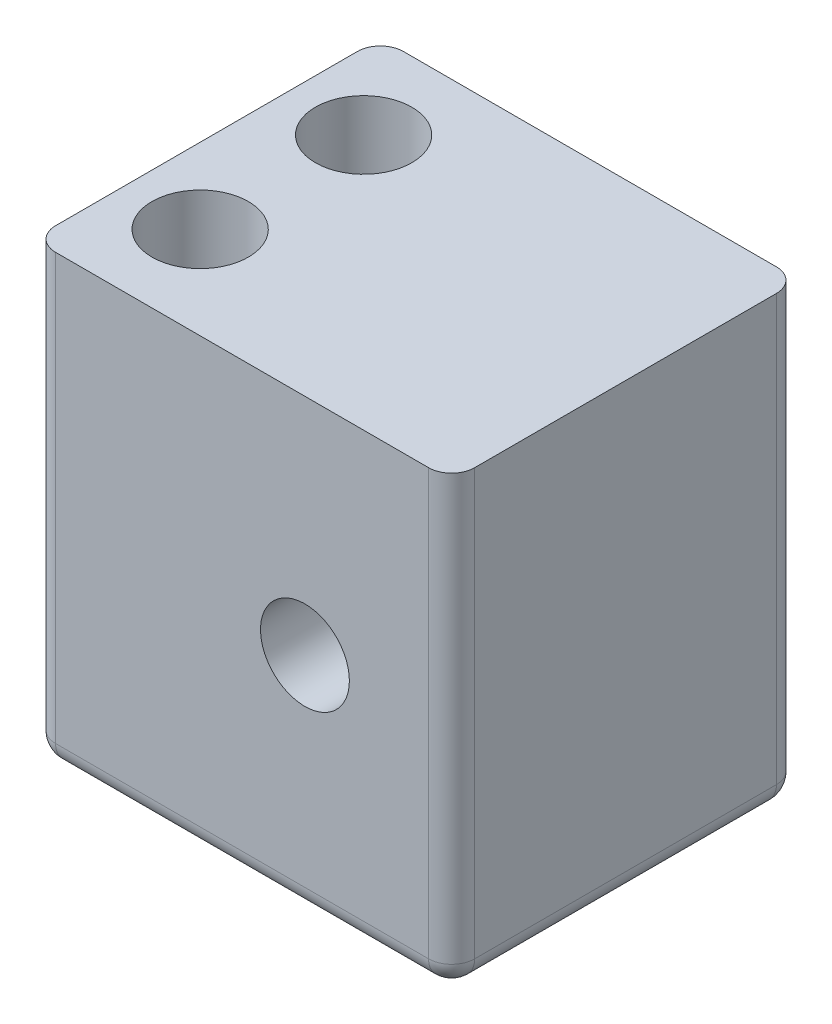
from build123d import *

# Parameters (mm, degrees)
SKETCH1_W           = 25.4
SKETCH1_H           = 21.082
BOSS_EXTRUDE1_DEPTH = 27.178
SKETCH2_R           = 2.921
CUT_EXTRUDE1_DEPTH  = 8.5598
SKETCH3_R           = 2.6924
CUT_EXTRUDE2_DEPTH  = 37.665847979
SKETCH9_R           = 1.9558
CUT_EXTRUDE4_DEPTH  = 27.178
CUT_EXTRUDE3_DEPTH  = 5.08
CUT_EXTRUDE5_START  = -7.62
CUT_EXTRUDE5_DEPTH  = 1.4478
FILLET1_R           = 1.397
FILLET2_R           = 0.635


with BuildPart() as part:
    # Sketch1 → Boss-Extrude1 (new body)
    with BuildSketch(Plane(origin=(0, 0, 0), x_dir=(1, 0, 0), z_dir=(0, 1, 0))):
        Rectangle(SKETCH1_W, SKETCH1_H)
    extrude(amount=BOSS_EXTRUDE1_DEPTH)

    # Sketch2 → Cut-Extrude1 (cut)
    with BuildSketch(Plane(origin=(0, 27.178, 0), x_dir=(1, 0, 0), z_dir=(0, 1, 0))):
        with Locations(Location((-8.128, -4.953, 0), (0, 0, 270))):
            Circle(SKETCH2_R)
        with Locations(Location((-8.128, 4.953, 0), (0, 0, 270))):
            Circle(SKETCH2_R)
    extrude(amount=-CUT_EXTRUDE1_DEPTH, mode=Mode.SUBTRACT)

    # Sketch3 → Cut-Extrude2 (cut, through all)
    with BuildSketch(Plane.XY.offset(10.541)):
        with Locations((3.81, 13.589)):
            Circle(SKETCH3_R)
    extrude(amount=-CUT_EXTRUDE2_DEPTH, mode=Mode.SUBTRACT)

    # Sketch9 → Cut-Extrude4 (cut)
    with BuildSketch(Plane(origin=(0, 27.178, 0), x_dir=(1, 0, 0), z_dir=(0, 1, 0))):
        with Locations(Location((-8.128, 4.953, 0), (0, 0, 270))):
            Circle(SKETCH9_R)
        with Locations(Location((-8.128, -4.953, 0), (0, 0, 270))):
            Circle(SKETCH9_R)
    extrude(amount=-CUT_EXTRUDE4_DEPTH, mode=Mode.SUBTRACT)

    # Sketch5 → Cut-Extrude3 (cut)
    with BuildSketch(Plane.ZY.offset(12.7)):
        with BuildLine():
            Line((-6.303, 11.494), (-6.303, 0))
            Line((-6.303, 0), (6.397, 0))
            Line((6.397, 0), (6.397, 11.494))
            ThreePointArc((6.397, 11.494), (0.047, 17.844), (-6.303, 11.494))
        make_face()
    extrude(amount=-CUT_EXTRUDE3_DEPTH, mode=Mode.SUBTRACT)

    # Cut-Extrude5: read off the stored shape, not the designer's step
    # Cut-Extrude5 outline → Cut-Extrude5 (cut)
    with BuildSketch(Plane.YZ.offset(CUT_EXTRUDE5_START)):
        with BuildLine():
            Line((15.525583312, 4.953), (0, 4.953))
            Line((0, 4.953), (0, -4.953))
            Line((0, -4.953), (15.408396505, -4.953))
            ThreePointArc((15.408396505, -4.953), (17.843555718, -0.028114492), (15.525583312, 4.953))
        make_face()
    extrude(amount=CUT_EXTRUDE5_DEPTH, mode=Mode.SUBTRACT)

    # Fillet1
    fillet1_edges = [part.edges().sort_by_distance(p)[0] for p in [
        (-12.7, 0, 8.469),
        (0, 0, 10.541),
        (-12.7, 0, -8.422),
        (0, 0, -10.541),
        (12.7, 0, 0),
        (12.7, 13.589, 10.541),
        (-12.7, 13.589, 10.541),
        (-12.7, 13.589, -10.541),
        (12.7, 13.589, -10.541),
    ]]
    fillet(fillet1_edges, radius=FILLET1_R)

    # Fillet2
    fillet2_edges = [part.edges().sort_by_distance(p)[0] for p in [
        (-7.400882257, 0, -6.768613788),
        (-10.375048641, 0, 6.397),
        (-10.423075727, 0, -6.303),
        (-12.7, 17.844, 0.047),
        (-12.7, 6.4455, -6.303),
        (-6.745040557, 0, 6.335959443),
        (-6.1722, 0, 0),
        (-12.7, 6.4455, 6.397),
        (-12.290828173, 0.409171827, -6.303),
        (-12.290828173, 0.409171827, 6.397),
    ]]
    fillet(fillet2_edges, radius=FILLET2_R)


solid = part.part
